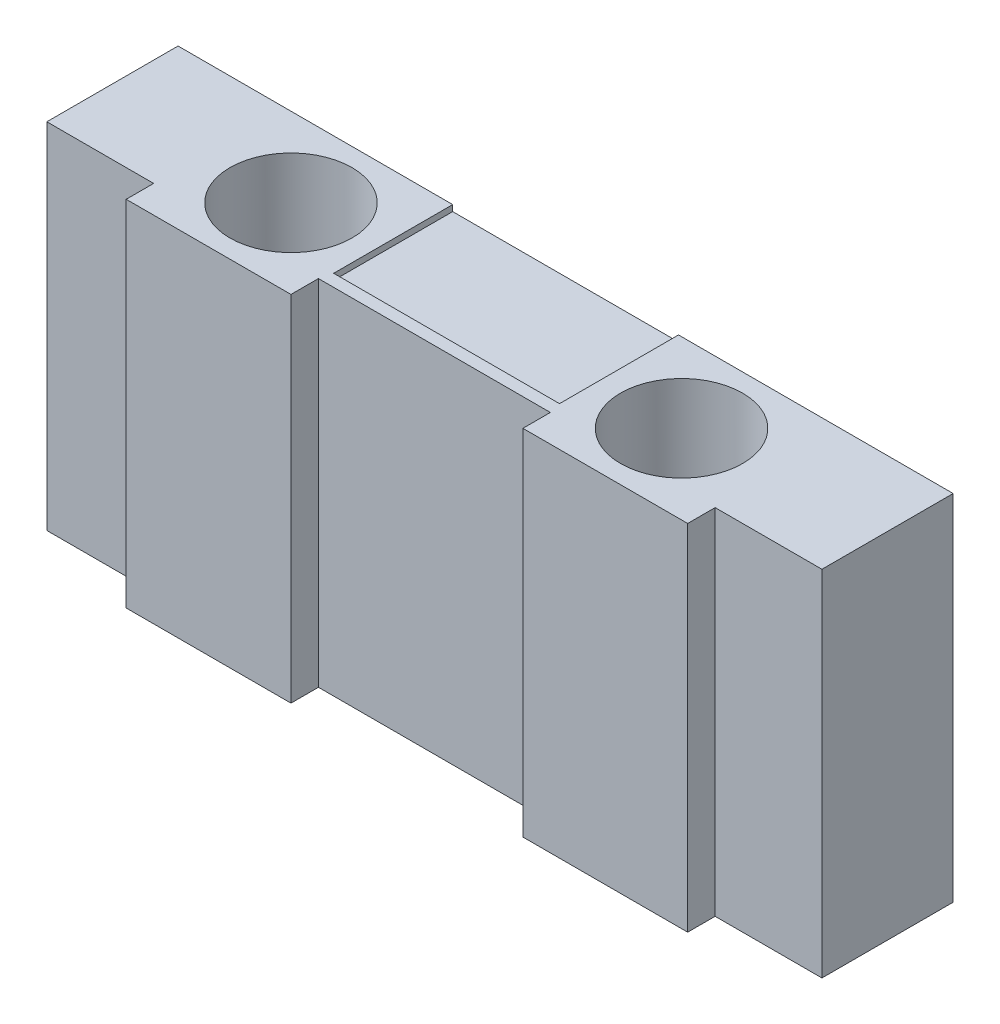
from build123d import *

# Parameters (mm, degrees)
SALIENTE_EXTRUIR1_DEPTH = 2.6
CROQUIS2_R              = 1
CORTAR_EXTRUIR1_DEPTH   = 3
CROQUIS4_W              = 3.7
CROQUIS4_H              = 0.1
SALIENTE_EXTRUIR2_DEPTH = 0.8
CHAFL_N1_SIZE           = 0.15
CROQUIS5_W              = 3.8
CROQUIS5_H              = 5.8
CROQUIS5_W_2            = 1.75
CORTAR_EXTRUIR2_DEPTH   = 0.45


with BuildPart() as part:
    # Croquis1 → Saliente-Extruir1 (new body)
    with BuildSketch(Plane.XY):
        Polygon((-1.85, 2.8), (1.85, 2.8), (1.85, 2.9), (6.35, 2.9), (6.35, -2.9), (1.85, -2.9), (1.85, -2.8), (-1.85, -2.8), (-1.85, -2.9), (-6.35, -2.9), (-6.35, 2.9), (-1.85, 2.9), align=None)
    extrude(amount=SALIENTE_EXTRUIR1_DEPTH)

    # Croquis2 → Cortar-Extruir1 (cut, symmetric)
    with BuildSketch(Plane(origin=(0, 0, 0), x_dir=(1, 0, 0), z_dir=(0, 1, 0))):
        with Locations(Location((-3.2, -1.3, 0), (0, 0, 270))):
            Circle(CROQUIS2_R)
        with Locations(Location((3.2, -1.3, 0), (0, 0, 270))):
            Circle(CROQUIS2_R)
    extrude(amount=CORTAR_EXTRUIR1_DEPTH, both=True, mode=Mode.SUBTRACT)

    # Croquis4 → Saliente-Extruir2 (add)
    with BuildSketch(Plane.XY.offset(2.6)):
        with Locations((0, 2.85)):
            Rectangle(CROQUIS4_W, CROQUIS4_H)
        with Locations((0, -2.85)):
            Rectangle(CROQUIS4_W, CROQUIS4_H)
    extrude(amount=-SALIENTE_EXTRUIR2_DEPTH)

    # Chaflán1
    # the kernel refuses this chamfer: 0.15 mm, written as the material it takes off along each edge
    with BuildSketch(Plane(origin=(-1.85, -2.9, 1.8), x_dir=(0, -0.027495876610587378, 0.9996219169112965), z_dir=(1, 0, 0))) as chafl_n1_piece_1_section:
        Polygon((CHAFL_N1_SIZE * 0.999621916911, -CHAFL_N1_SIZE * 0.0274958766106), (-CHAFL_N1_SIZE * 0.0274958766106, -CHAFL_N1_SIZE * 0.999621916911), (0, 0), align=None)
    chafl_n1_piece_1 = extrude(amount=3.7, mode=Mode.PRIVATE)
    chafl_n1_piece_1 = split(chafl_n1_piece_1, bisect_by=Plane(origin=(0, -2.8, 1.85460455), z_dir=(0, -1, 0)), keep=Keep.TOP, mode=Mode.PRIVATE)
    add(chafl_n1_piece_1, mode=Mode.SUBTRACT)
    with BuildSketch(Plane(origin=(1.85, 2.9, 1.8), x_dir=(0, 0.027495876610587378, 0.9996219169112965), z_dir=(-1, 0, 0))) as chafl_n1_piece_2_section:
        Polygon((CHAFL_N1_SIZE * 0.999621916911, -CHAFL_N1_SIZE * 0.0274958766106), (-CHAFL_N1_SIZE * 0.0274958766106, -CHAFL_N1_SIZE * 0.999621916911), (0, 0), align=None)
    chafl_n1_piece_2 = extrude(amount=3.7, mode=Mode.PRIVATE)
    chafl_n1_piece_2 = split(chafl_n1_piece_2, bisect_by=Plane(origin=(0, 2.8, 1.85460455), z_dir=(0, 1, 0)), keep=Keep.TOP, mode=Mode.PRIVATE)
    add(chafl_n1_piece_2, mode=Mode.SUBTRACT)

    # Croquis5 → Cortar-Extruir2 (cut)
    with BuildSketch(Plane.XY.offset(2.6)):
        Rectangle(CROQUIS5_W, CROQUIS5_H)
        with Locations((-5.475, 0)):
            Rectangle(CROQUIS5_W_2, CROQUIS5_H)
        with Locations((5.475, 0)):
            Rectangle(CROQUIS5_W_2, CROQUIS5_H)
    extrude(amount=-CORTAR_EXTRUIR2_DEPTH, mode=Mode.SUBTRACT)


solid = part.part
